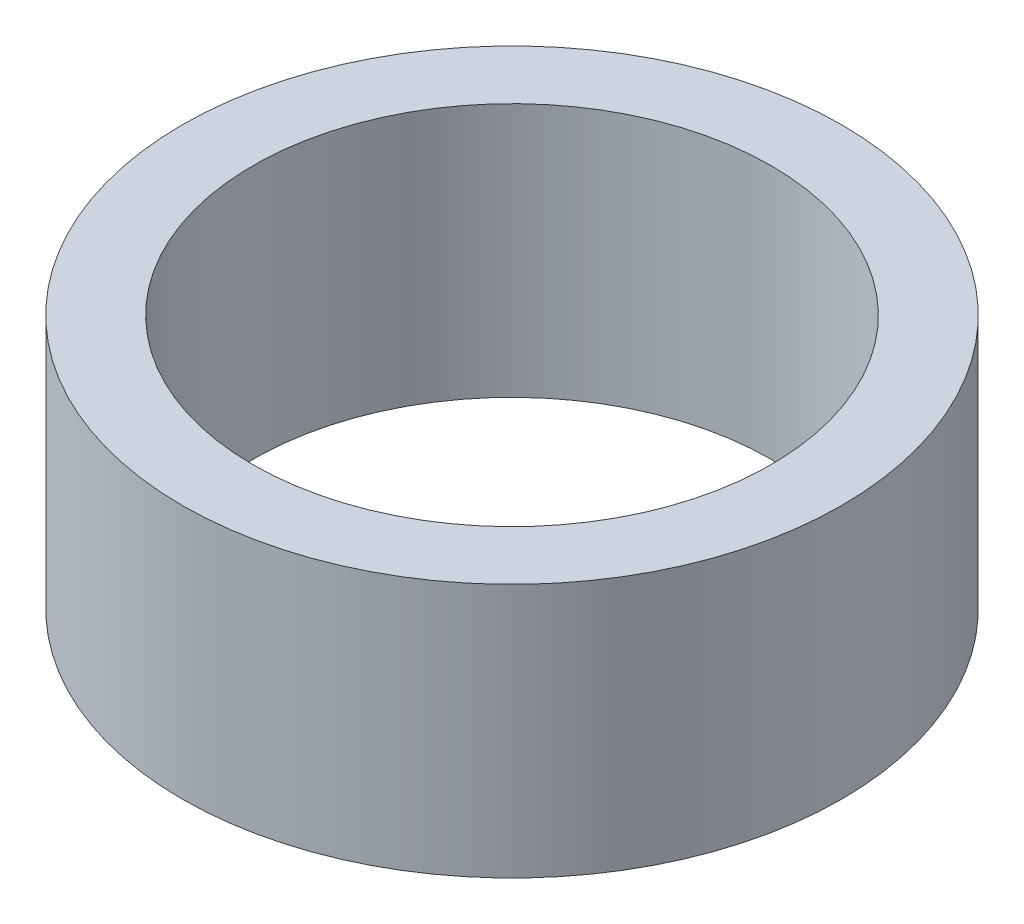
from build123d import *

# Parameters (mm, degrees)
SKETCH1_R           = 35
BOSS_EXTRUDE1_DEPTH = 27
SKETCH2_R           = 27.5
CUT_EXTRUDE1_DEPTH  = 57.382621436


with BuildPart() as part:
    # Sketch1 → Boss-Extrude1 (new body)
    with BuildSketch(Plane(origin=(0, 0, 0), x_dir=(1, 0, 0), z_dir=(0, 1, 0))):
        Circle(SKETCH1_R)
    extrude(amount=BOSS_EXTRUDE1_DEPTH)

    # Sketch2 → Cut-Extrude1 (cut, through all)
    with BuildSketch(Plane(origin=(0, 0, 0), x_dir=(1, 0, 0), z_dir=(0, 1, 0))):
        Circle(SKETCH2_R)
    extrude(amount=CUT_EXTRUDE1_DEPTH, mode=Mode.SUBTRACT)


solid = part.part
